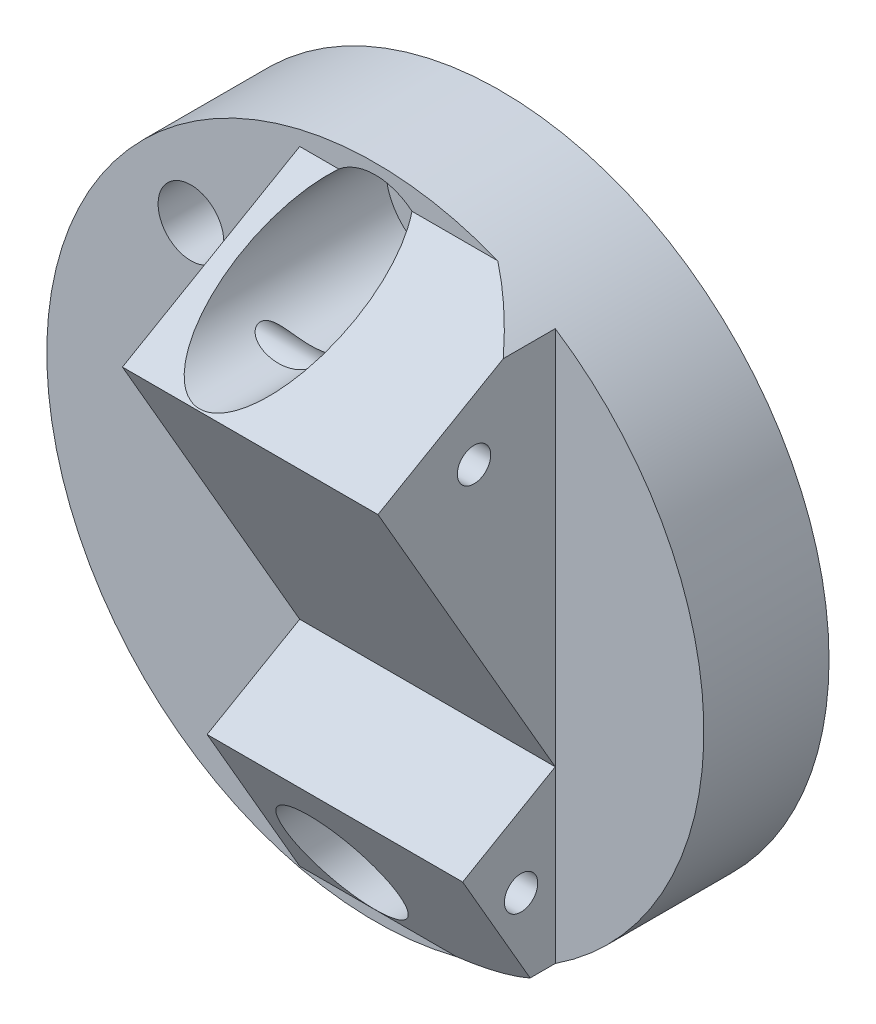
from build123d import *
from build123d.topology import SkipClean

# Parameters (mm, degrees)
SKETCH2_R                      = 31.5
BOSS_EXTRUDE1_DEPTH            = 12
CBORE_FOR_M6_SHCS1_D           = 6.4
CBORE_FOR_M6_SHCS1_CBORE_D     = 11
CBORE_FOR_M6_SHCS1_CBORE_DEPTH = 6.5
SKETCH5_R                      = 3.15
CUT_EXTRUDE1_DEPTH             = 12
BOSS_EXTRUDE2_DEPTH            = 24.5
CUT_EXTRUDE2_START             = 65
SKETCH7_R                      = 5.5
CUT_EXTRUDE2_DEPTH             = 65
BOSS_EXTRUDE3_REACH            = 66.882
CUT_EXTRUDE3_START             = 82
SKETCH9_R                      = 5.5
CUT_EXTRUDE3_DEPTH             = 82
SKETCH11_R                     = 51.4472096
SKETCH11_R_2                   = 31.5
CUT_EXTRUDE4_DEPTH             = 82
SKETCH12_R                     = 1.6
CUT_EXTRUDE5_DEPTH             = 52


with BuildPart() as part:
    # Sketch2 → Boss-Extrude1 (new body)
    with BuildSketch(Plane.XY):
        Circle(SKETCH2_R)
    extrude(amount=BOSS_EXTRUDE1_DEPTH)

    # CBORE for M6 SHCS1 (through all)
    with Locations(Plane.XY.offset(12)):
        with Locations((0, 25), (0, -25)):
            CounterBoreHole(CBORE_FOR_M6_SHCS1_D / 2, CBORE_FOR_M6_SHCS1_CBORE_D / 2, CBORE_FOR_M6_SHCS1_CBORE_DEPTH)

    # Sketch5 → Cut-Extrude1 (cut)
    with BuildSketch(Plane(origin=(0, 0, 0), x_dir=(-1, 0, 0), z_dir=(0, 0, -1))):
        with Locations((17.67766953, 17.67766953)):
            Circle(SKETCH5_R)
    extrude(amount=-CUT_EXTRUDE1_DEPTH, mode=Mode.SUBTRACT)

    # Sketch6 → Boss-Extrude2 (add)
    with BuildSketch(Plane(origin=(17.25, 0, 0), x_dir=(0, 0, -1), z_dir=(1, 0, 0))):
        Polygon((-12, 29.231895539), (-28.9984059, 19.417861316), (-12, -10.02424135), align=None)
    extrude(amount=-BOSS_EXTRUDE2_DEPTH)

    # Sketch7 → Cut-Extrude2 (cut)
    with BuildSketch(Plane.XY.offset(12).offset(CUT_EXTRUDE2_START)):
        with Locations((0, 25)):
            Circle(SKETCH7_R)
    extrude(amount=-CUT_EXTRUDE2_DEPTH, mode=Mode.SUBTRACT)

    # Boss-Extrude3: up to this face of the body (flat: up to its plane)
    boss_extrude3_end = Plane(part.part.faces().sort_by_distance((-7.25, 12.875171835, 17.6661353))[0])
    # Sketch8 → Boss-Extrude3 (add, up to the picked face)
    with BuildSketch(Plane(origin=(17.25, 0, 0), x_dir=(0, 0, -1), z_dir=(1, 0, 0)), mode=Mode.PRIVATE) as boss_extrude3_sk1:
        Polygon((-12, -10.02424135), (-20.878095029, -15.150011905), (-12, -30.52732357), align=None)
    boss_extrude3_tool1 = split(extrude(boss_extrude3_sk1.sketch, amount=-BOSS_EXTRUDE3_REACH, mode=Mode.PRIVATE), bisect_by=boss_extrude3_end, keep=Keep.BOTH, mode=Mode.PRIVATE)
    add(boss_extrude3_tool1.solids().sort_by(Axis((17.25, -18.567192, 14.959365), (-1, 0, 0)))[0])

    # Sketch9 → Cut-Extrude3 (cut)
    with BuildSketch(Plane.XY.offset(12).offset(CUT_EXTRUDE3_START)):
        with Locations((0, -25)):
            Circle(SKETCH9_R)
    extrude(amount=-CUT_EXTRUDE3_DEPTH, mode=Mode.SUBTRACT)

    # Sketch11 → Cut-Extrude4 (cut)
    with SkipClean():  # the faces are left unmerged after this step: merging them gives an invalid solid
        with BuildSketch(Plane(origin=(0, 0, 0), x_dir=(-1, 0, 0), z_dir=(0, 0, -1))):
            Circle(SKETCH11_R)
            with Locations(Location((0, 0, 0), (0, 0, 255.72452839))):
                Circle(SKETCH11_R_2, mode=Mode.SUBTRACT)
        extrude(amount=-CUT_EXTRUDE4_DEPTH, mode=Mode.SUBTRACT)
    add(part.part.scale(1), mode=Mode.REPLACE)  # the faces are merged on a copy

    # Sketch12 → Cut-Extrude5 (cut)
    with BuildSketch(Plane.ZY.offset(7.25)):
        with Locations((19.788303121, 18.963925862)):
            Circle(SKETCH12_R)
        with Locations((15.278684177, -18.84696327)):
            Circle(SKETCH12_R)
    extrude(amount=-CUT_EXTRUDE5_DEPTH, mode=Mode.SUBTRACT)


solid = part.part
